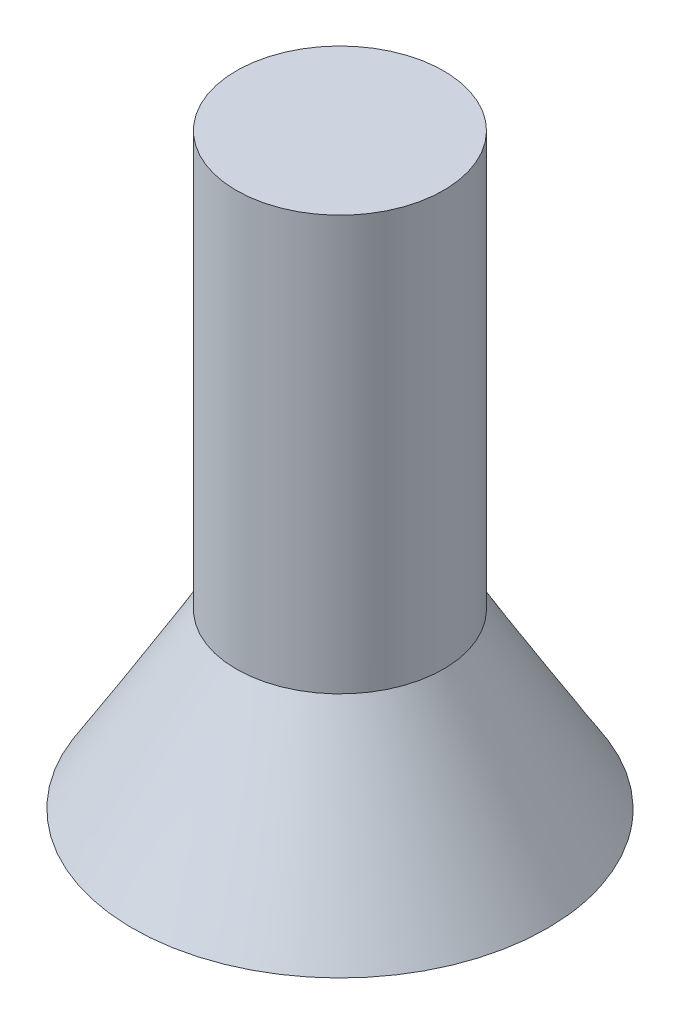
from build123d import *

# Parameters (mm, degrees)
SKETCH_3_R          = 1.5
EXTRUDE_1_DEPTH     = 6
CUT_EXTRUDE_1_DEPTH = 0.5


with BuildPart() as part:
    # 放样1: read off the stored shape, not the designer's step
    # 放样1: loft between two sections, ruled curve by curve
    loft_1_from = [
        Edge.make_bspline([(-2.696565737, 0, 1.314736942), (-0.067091854, 0, 6.707868416), (5.32603962, 0, 4.078394533), (2.696565737, 0, -1.314736942), (0.067091854, 0, -6.707868416), (-5.32603962, 0, -4.078394533), (-2.696565737, 0, 1.314736942)], [0, 0, 0, 0, 0.5, 0.5, 0.5, 1, 1, 1, 1], 3, [1, 0.333333333, 0.333333333, 1, 0.333333333, 0.333333333, 1]),
    ]
    loft_1_to = [
        Edge.make_bspline([(-1.463875143, 2.5, 0.327214862), (-0.809445419, 2.5, 3.254965148), (2.118304867, 2.5, 2.600535424), (1.463875143, 2.5, -0.327214862), (0.809445419, 2.5, -3.254965148), (-2.118304867, 2.5, -2.600535424), (-1.463875143, 2.5, 0.327214862)], [0, 0, 0, 0, 0.5, 0.5, 0.5, 1, 1, 1, 1], 3, [1, 0.333333333, 0.333333333, 1, 0.333333333, 0.333333333, 1]),
    ]
    loft_1 = Solid(Shell([*[Face.make_surface_from_curves(loft_1_from[k], loft_1_to[k]) for k in range(1)], Face(Wire(loft_1_from)), Face(Wire(loft_1_to))]))
    add(loft_1)

    # 草图3 → 凸台-拉伸1 (add)
    with BuildSketch(Plane(origin=(0, 2.5, 0), x_dir=(1, 0, 0), z_dir=(0, 1, 0))):
        with Locations(Location((0, 0, 0), (0, 0, 192.6))):
            Circle(SKETCH_3_R)
    extrude(amount=EXTRUDE_1_DEPTH)

    # 草图4 → 切除-拉伸1 (cut)
    with BuildSketch(Plane.XZ):
        Polygon((0.577350269, 1), (-0.577350269, 1), (-1.154700538, 0), (-0.577350269, -1), (0.577350269, -1), (1.154700538, 0), align=None)
    extrude(amount=-CUT_EXTRUDE_1_DEPTH, mode=Mode.SUBTRACT)


solid = part.part
